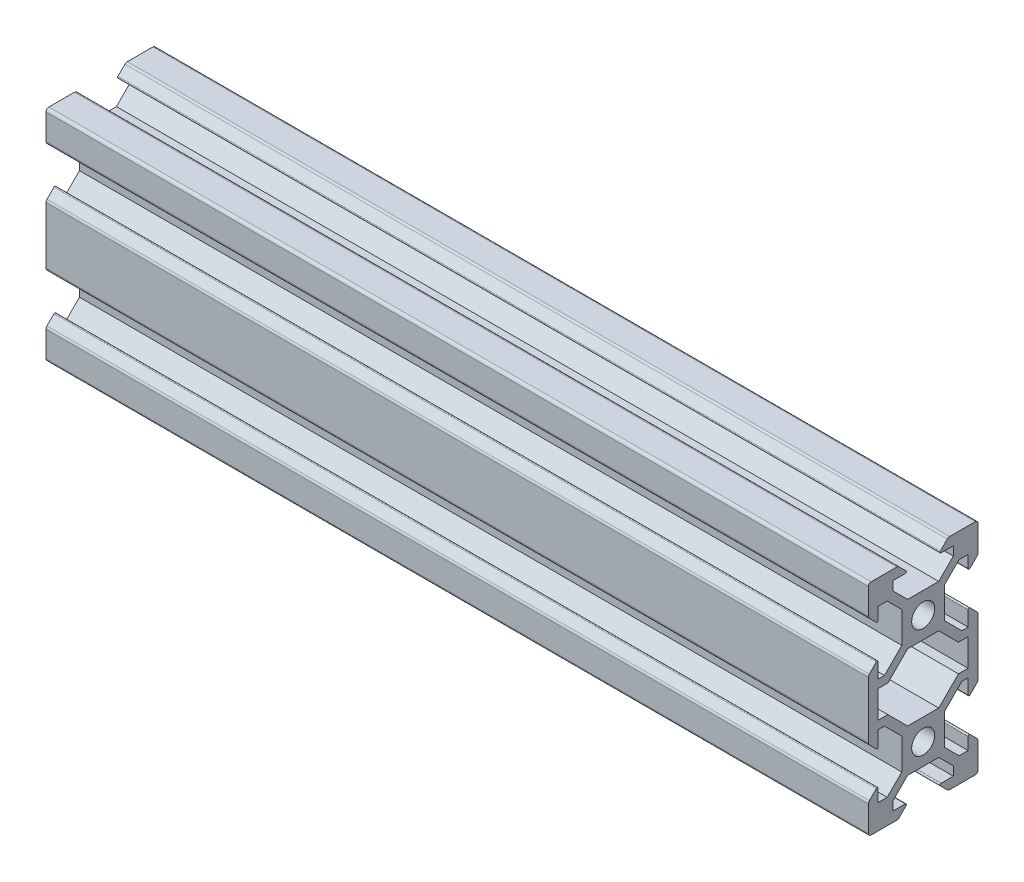
from build123d import *

# Parameters (mm, degrees)
SKETCH1_R           = 2
BOSS_EXTRUDE1_DEPTH = 75


# Read off the part's stored shape, not the designer's step: M5 Tapped Hole1
with BuildPart() as part:
    # Sketch1 → Boss-Extrude1 (new, symmetric)
    with BuildSketch(Plane(origin=(0, 0, 0), x_dir=(0, 0, -1), z_dir=(1, 0, 0))):
        with BuildLine():
            Line((-10, 0), (-8.2, 0))
            Line((-8.2, 0), (-8.2, -2.5))
            Line((-8.2, -2.5), (-6.43933983, -2.5))
            Line((-6.43933983, -2.5), (-2.839339831, -6.099999999))
            Line((-2.839339831, -6.099999999), (2.839339828, -6.099999999))
            Line((2.839339828, -6.099999999), (6.439339829, -2.499999999))
            Line((6.439339829, -2.499999999), (8.2, -2.499999999))
            Line((8.2, -2.499999999), (8.2, 0))
            Line((8.2, 0), (10, 0))
            Line((10, 0), (10, -5.167329724))
            ThreePointArc((10, -5.167329724), (9.953566515, -5.400766617), (9.821335137, -5.59866486))
            Line((9.821335137, -5.59866486), (8.541421356, -6.87857864))
            ThreePointArc((8.541421356, -6.87857864), (8.323463314, -6.921933191), (8.2, -6.737157284))
            Line((8.2, -6.737157284), (8.2, -3.999999998))
            Line((8.2, -3.999999998), (7.06066017, -3.999999998))
            Line((7.06066017, -3.999999998), (3.9, -7.160660168))
            Line((3.9, -7.160660168), (3.9, -12.83933983))
            Line((3.9, -12.83933983), (6.560660169, -15.499999999))
            Line((6.560660169, -15.499999999), (8.2, -15.499999999))
            Line((8.2, -15.499999999), (8.2, -13.262842712))
            ThreePointArc((8.2, -13.262842712), (8.323463314, -13.078066805), (8.541421356, -13.121421355))
            Line((8.541421356, -13.121421355), (9.821335137, -14.401335136))
            ThreePointArc((9.821335137, -14.401335136), (9.953566515, -14.599233379), (10, -14.832670272))
            Line((10, -14.832670272), (10, -19.499999999))
            ThreePointArc((10, -19.499999999), (9.853553391, -19.85355339), (9.5, -19.999999999))
            Line((9.5, -19.999999999), (4.832670273, -19.999999999))
            ThreePointArc((4.832670273, -19.999999999), (4.599233379, -19.953566514), (4.401335137, -19.821335136))
            Line((4.401335137, -19.821335136), (3.121421356, -18.541421355))
            ThreePointArc((3.121421356, -18.541421355), (3.078066806, -18.323463313), (3.262842712, -18.199999999))
            Line((3.262842712, -18.199999999), (5.5, -18.199999999))
            Line((5.5, -18.199999999), (5.5, -16.560660171))
            Line((5.5, -16.560660171), (2.839339828, -13.899999999))
            Line((2.839339828, -13.899999999), (-2.839339828, -13.899999999))
            Line((-2.839339828, -13.899999999), (-5.5, -16.560660171))
            Line((-5.5, -16.560660171), (-5.5, -18.199999999))
            Line((-5.5, -18.199999999), (-3.262842712, -18.199999999))
            ThreePointArc((-3.262842712, -18.199999999), (-3.078066806, -18.323463313), (-3.121421356, -18.541421355))
            Line((-3.121421356, -18.541421355), (-4.401335137, -19.821335136))
            ThreePointArc((-4.401335137, -19.821335136), (-4.599233379, -19.953566514), (-4.832670273, -19.999999999))
            Line((-4.832670273, -19.999999999), (-9.5, -19.999999999))
            ThreePointArc((-9.5, -19.999999999), (-9.853553391, -19.85355339), (-10, -19.499999999))
            Line((-10, -19.499999999), (-10, -14.832670272))
            ThreePointArc((-10, -14.832670272), (-9.953566515, -14.599233379), (-9.821335137, -14.401335136))
            Line((-9.821335137, -14.401335136), (-8.541421356, -13.121421355))
            ThreePointArc((-8.541421356, -13.121421355), (-8.323463314, -13.078066805), (-8.2, -13.262842712))
            Line((-8.2, -13.262842712), (-8.2, -15.499999999))
            Line((-8.2, -15.499999999), (-6.560660172, -15.499999999))
            Line((-6.560660172, -15.499999999), (-3.9, -12.839339827))
            Line((-3.9, -12.839339827), (-3.9, -7.160660171))
            Line((-3.9, -7.160660171), (-7.06066017, -4.000000001))
            Line((-7.06066017, -4.000000001), (-8.2, -4.000000001))
            Line((-8.2, -4.000000001), (-8.2, -6.737157287))
            ThreePointArc((-8.2, -6.737157287), (-8.323463314, -6.921933193), (-8.541421356, -6.878578643))
            Line((-8.541421356, -6.878578643), (-9.821335137, -5.598664863))
            ThreePointArc((-9.821335137, -5.598664863), (-9.953566515, -5.40076662), (-10, -5.167329726))
            Line((-10, -5.167329726), (-10, 0))
        make_face()
        with Locations((0, -9.999999999)):
            Circle(SKETCH1_R, mode=Mode.SUBTRACT)
    boss_extrude1 = extrude(amount=BOSS_EXTRUDE1_DEPTH, both=True)


with BuildPart() as mirror1_1:
    # Mirror1: Boss-Extrude1 across Top Plane
    add(boss_extrude1.mirror(Plane(origin=(0, 0, 0), x_dir=(1, 0, 0), z_dir=(0, 1, 0))))


with BuildPart() as part_1:
    add(part.part)

    # Mirror1 united with what the copies touc: union Mirror1_1
    add(mirror1_1.part)

    # M5 Tapped Hole1 outline → M5 Tapped Hole1 (revolve, cut)
    with BuildSketch(Plane(origin=(0, 9.999999999, 0), x_dir=(0, 1, 0), z_dir=(0, 0, -1))):
        Polygon((2.1, -62.6), (2, -62.539913938), (2, -75), (2.1, -75), align=None)
        Polygon((2, 75), (2, 62.539913938), (2.1, 62.6), (2.1, 75), align=None)
    revolve(axis=Axis((0, 9.999999999, 0), (1, 0, 0)), mode=Mode.SUBTRACT)

    # M5 Tapped Hole1 2 outline → M5 Tapped Hole1 2 (revolve, cut)
    with BuildSketch(Plane(origin=(0, -9.999999999, 0), x_dir=(0, 1, 0), z_dir=(0, 0, -1))):
        Polygon((2.1, -62.6), (2, -62.539913938), (2, -75), (2.1, -75), align=None)
        Polygon((2, 75), (2, 62.539913938), (2.1, 62.6), (2.1, 75), align=None)
    revolve(axis=Axis((0, -9.999999999, 0), (1, 0, 0)), mode=Mode.SUBTRACT)


solid = part_1.part
